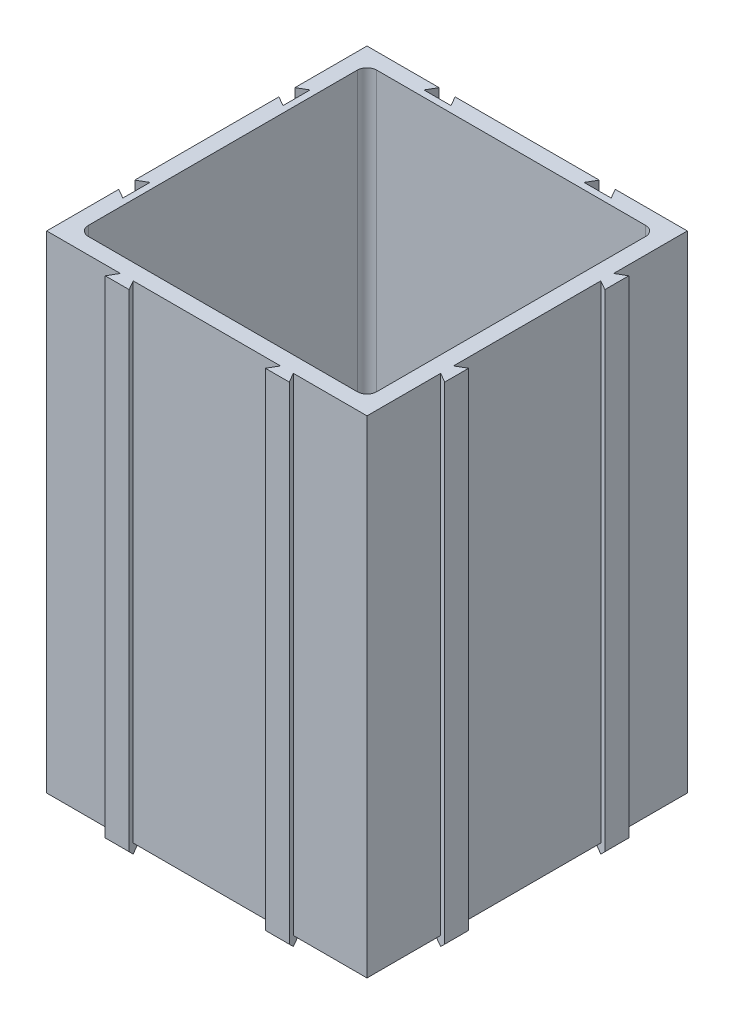
from build123d import *

# Parameters (mm, degrees)
BOSS_EXTRUDE1_DEPTH     = 77.5
SKETCH2_W               = 45
SKETCH2_H               = 45
BOSS_EXTRUDE2_DEPTH     = 2.5
CUT_EXTRUDE1_DEPTH      = 93.478375851
CUT_EXTRUDE1_DEPTH_BACK = 93.478375851
SKETCH3_R               = 1.5
CHAMFER3_SIZE           = 1.5
CHAMFER2_SIZE           = 1
FILLET1_R               = 1.5


with BuildPart() as part:
    # Sketch1 → Boss-Extrude1 (new body)
    with BuildSketch(Plane(origin=(0, 0, 0), x_dir=(1, 0, 0), z_dir=(0, 1, 0))):
        Polygon((-11, 2.116025404), (-11, -2.116025404), (-12.5, -1.25), (-12.5, -12.5), (-1, -12.5), (-1.866025404, -14), (1.866025404, -14), (1, -12.5), (12.5, -12.5), (24, -12.5), (23.133974596, -14), (26.866025404, -14), (26, -12.5), (37.5, -12.5), (37.5, -1), (39, -1.866025404), (39, 1.866025404), (37.5, 1), (37.5, 12.5), (37.5, 24), (39, 23.133974596), (39, 26.866025404), (37.5, 26), (37.5, 37.5), (26.25, 37.5), (27.116025404, 36), (22.883974596, 36), (23.75, 37.5), (12.5, 37.5), (1.25, 37.5), (2.116025404, 36), (-2.116025404, 36), (-1.25, 37.5), (-12.5, 37.5), (-12.5, 26.25), (-11, 27.116025404), (-11, 22.883974596), (-12.5, 23.75), (-12.5, 12.5), (-12.5, 1.25), align=None)
        Polygon((-10, 10), (-10, -10), (10, -10), (15, -10), (35, -10), (35, 10), (35, 15), (35, 35), (15, 35), (10, 35), (-10, 35), (-10, 15), align=None, mode=Mode.SUBTRACT)
    extrude(amount=BOSS_EXTRUDE1_DEPTH)

    # Sketch2 → Boss-Extrude2 (add)
    with BuildSketch(Plane(origin=(0, 0, 0), x_dir=(1, 0, 0), z_dir=(0, 1, 0))):
        with Locations((12.5, 12.5)):
            Rectangle(SKETCH2_W, SKETCH2_H)
    extrude(amount=BOSS_EXTRUDE2_DEPTH)

    # Sketch3 → Cut-Extrude1 (cut, two sides: drawn at the far end of the back side and taken through both)
    with BuildSketch(Plane(origin=(0, 2.5, 0), x_dir=(1, 0, 0), z_dir=(0, 1, 0)).offset(-CUT_EXTRUDE1_DEPTH_BACK)):
        with Locations(Location((-6, 6, 0), (0, 0, 270))):
            Circle(SKETCH3_R)
        with Locations(Location((6, 6, 0), (0, 0, 270))):
            Circle(SKETCH3_R)
        with Locations(Location((6, -6, 0), (0, 0, 270))):
            Circle(SKETCH3_R)
        with Locations(Location((-6, -6, 0), (0, 0, 270))):
            Circle(SKETCH3_R)
        with Locations(Location((31, -6, 0), (0, 0, 270))):
            Circle(SKETCH3_R)
        with Locations(Location((19, -6, 0), (0, 0, 270))):
            Circle(SKETCH3_R)
        with Locations(Location((19, 6, 0), (0, 0, 270))):
            Circle(SKETCH3_R)
        with Locations(Location((31, 6, 0), (0, 0, 270))):
            Circle(SKETCH3_R)
        with Locations(Location((31, 19, 0), (0, 0, 270))):
            Circle(SKETCH3_R)
        with Locations(Location((19, 19, 0), (0, 0, 270))):
            Circle(SKETCH3_R)
        with Locations(Location((19, 31, 0), (0, 0, 270))):
            Circle(SKETCH3_R)
        with Locations(Location((31, 31, 0), (0, 0, 270))):
            Circle(SKETCH3_R)
        with Locations(Location((-6, 31, 0), (0, 0, 270))):
            Circle(SKETCH3_R)
        with Locations(Location((6, 31, 0), (0, 0, 270))):
            Circle(SKETCH3_R)
        with Locations(Location((6, 19, 0), (0, 0, 270))):
            Circle(SKETCH3_R)
        with Locations(Location((-6, 19, 0), (0, 0, 270))):
            Circle(SKETCH3_R)
    extrude(amount=CUT_EXTRUDE1_DEPTH + CUT_EXTRUDE1_DEPTH_BACK, mode=Mode.SUBTRACT)

    # Chamfer3
    chamfer3_edges = [part.edges().sort_by_distance(p)[0] for p in [
        (39, 0, -25),
        (0, 0, 14),
        (25, 0, 14),
        (39, 0, 0),
        (-11, 0, 0),
        (-11, 0, -25),
        (0, 0, -36),
        (25, 0, -36),
        (-12.5, 0, -12.5),
        (-12.5, 0, 6.875),
        (-6.75, 0, 12.5),
        (12.5, 0, 12.5),
        (31.75, 0, 12.5),
        (37.5, 0, 6.75),
        (37.5, 0, -12.5),
        (-12.5, 0, -31.875),
        (-6.875, 0, -37.5),
        (12.5, 0, -37.5),
        (37.5, 0, -31.75),
        (31.875, 0, -37.5),
    ]]
    chamfer(chamfer3_edges, length=CHAMFER3_SIZE - 0.0001)  # a hair under: the kernel refuses the full size

    # Chamfer2
    chamfer2_edges = [part.edges().sort_by_distance(p)[0] for p in [
        (12.5, 2.5, -35),
        (-10, 2.5, -12.5),
        (12.5, 2.5, 10),
        (35, 2.5, -12.5),
        (31, 2.5, -20.5),
        (31, 2.5, -7.5),
        (19, 2.5, -7.5),
        (19, 2.5, 4.5),
        (6, 2.5, -7.5),
        (6, 2.5, 4.5),
        (-6, 2.5, 4.5),
        (31, 2.5, 4.5),
        (-6, 2.5, -20.5),
        (6, 2.5, -20.5),
        (6, 2.5, -32.5),
        (19, 2.5, -20.5),
        (19, 2.5, -32.5),
        (31, 2.5, -32.5),
        (-6, 2.5, -32.5),
        (-6, 2.5, -7.5),
    ]]
    chamfer(chamfer2_edges, length=CHAMFER2_SIZE)

    # Fillet1
    fillet1_edges = [part.edges().sort_by_distance(p)[0] for p in [
        (35, 40.5, -35),
        (-10, 40.5, -35),
        (-10, 40.5, 10),
        (35, 40.5, 10),
    ]]
    fillet(fillet1_edges, radius=FILLET1_R)


solid = part.part
